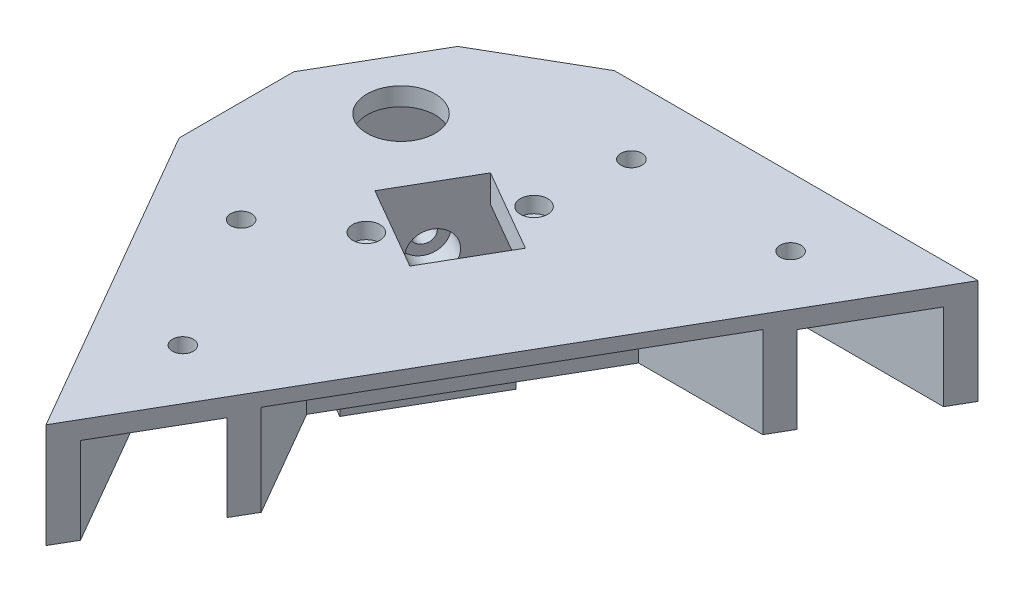
from build123d import *

# Parameters (mm, degrees)
BOSS_EXTRUDE1_DEPTH      = 23
SKETCH2_W                = 100.39999999999999
SKETCH2_H                = 20.400000000000002
CUT_EXTRUDE2_DEPTH       = 19
CUT_EXTRUDE3_DEPTH       = 19
CUT_EXTRUDE11_DEPTH      = 200.75985582694003
CUT_EXTRUDE11_DEPTH_BACK = 200.75985582694003
CUT_EXTRUDE10_DEPTH      = 20
SKETCH38_R               = 2.299999999999993
SKETCH38_R_2             = 2.300000000000006
SKETCH38_R_3             = 2.2999999999999985
SKETCH38_R_4             = 2.299999999999992
CUT_EXTRUDE24_DEPTH      = 10
BOSS_EXTRUDE2_DEPTH      = 6
SKETCH40_R               = 1.6500000000000017
CUT_EXTRUDE25_DEPTH      = 200.1582285520733
SKETCH41_R               = 3.0000000000000084
CUT_EXTRUDE26_DEPTH      = 3.5
SKETCH45_R               = 2.3
CUT_EXTRUDE29_DEPTH      = 130.1236252028075
SKETCH47_R               = 7.499999999999999
CUT_EXTRUDE31_DEPTH      = 10
CUT_EXTRUDE32_DEPTH      = 200.75985582694003
BOSS_EXTRUDE3_DEPTH      = 21
CUT_EXTRUDE33_DEPTH      = 200.75985582694003
CHAMFER6_SIZE            = 0.8
CHAMFER6_SIZE2           = 9.144041842209413
SKETCH51_R               = 4.5
CUT_EXTRUDE34_DEPTH      = 29.803050969
SKETCH52_R               = 2.3
CUT_EXTRUDE35_DEPTH      = 10
SKETCH53_W               = 20.000000000000007
SKETCH53_H               = 20
CUT_EXTRUDE36_DEPTH      = 10
SKETCH54_R               = 0.8500000000000069
CUT_EXTRUDE37_DEPTH      = 10
CHAMFER7_SIZE            = 1
CHAMFER7_SIZE_2          = 1.710027066
CHAMFER5_SIZE            = 14.54
CHAMFER4_SIZE            = 14.54


with BuildPart() as part:
    # Sketch1 → Boss-Extrude1 (new body)
    with BuildSketch(Plane(origin=(0, 0, 0), x_dir=(1, 0, 0), z_dir=(0, 1, 0))):
        Polygon((0, 0), (149.99999999999937, 0), (74.99999999999966, 129.903810567666), align=None)
    extrude(amount=BOSS_EXTRUDE1_DEPTH)

    # Sketch2 → Cut-Extrude2 (cut)
    with BuildSketch(Plane(origin=(0, 0, 0), x_dir=(1, 0, 0), z_dir=(0, 1, 0))):
        Polygon((108.9238401753675, 138.2616253392494), (58.72384017536752, 51.31267479929176), (41.05692193816496, 61.51267479929177), (91.25692193816495, 148.4616253392494), align=None)
        with Locations((124, 15.000000000000002)):
            Rectangle(SKETCH2_W, SKETCH2_H)
    extrude(amount=CUT_EXTRUDE2_DEPTH, mode=Mode.SUBTRACT)

    # Sketch4 → Cut-Extrude3 (cut)
    with BuildSketch(Plane(origin=(0, 0, 0), x_dir=(1, 0, 0), z_dir=(0, 1, 0))):
        Polygon((58.51558394542647, 45.56193363414623), (40.84866570822394, 35.36193363414623), (51.048665708223936, 17.69501539694368), (68.71558394542647, 27.895015396943673), align=None)
    extrude(amount=CUT_EXTRUDE3_DEPTH, mode=Mode.SUBTRACT)

    # Sketch22 → Cut-Extrude11 (cut, two sides: drawn at the far end of the back side and taken through both)
    with BuildSketch(Plane.XZ.offset(-CUT_EXTRUDE11_DEPTH_BACK)):
        Polygon((79.88924971530794, -26.147760514529192), (62.58924971530795, -56.11223948547077), (80.77578319478118, -66.61223948547077), (98.07578319478117, -36.64776051452918), align=None)
    extrude(amount=CUT_EXTRUDE11_DEPTH + CUT_EXTRUDE11_DEPTH_BACK, mode=Mode.SUBTRACT)

    # Sketch21 → Cut-Extrude10 (cut)
    with BuildSketch(Plane.XZ):
        Polygon((132.67949192431067, -29.999999999999993), (105.37797113249052, -29.999999999999993), (78.6697476797782, -76.26000000000042), (92.32050807568827, -99.90381056766569), align=None)
    extrude(amount=-CUT_EXTRUDE10_DEPTH, mode=Mode.SUBTRACT)

    # Sketch38 → Cut-Extrude24 (cut)
    with BuildSketch(Plane.XZ.offset(-19)):
        with Locations(Location((88.79999999999998, -15, 0), (0, 0, 270))):
            Circle(SKETCH38_R)
        with Locations(Location((123.8, -15, 0), (0, 0, 270))):
            Circle(SKETCH38_R_2)
        with Locations(Location((57.390381056766245, -69.40305585605834, 0), (0, 0, 270))):
            Circle(SKETCH38_R_3)
        with Locations(Location((74.89038105676623, -99.7139449885137, 0), (0, 0, 270))):
            Circle(SKETCH38_R_4)
    extrude(amount=-CUT_EXTRUDE24_DEPTH, mode=Mode.SUBTRACT)

    # Sketch39 → Boss-Extrude2 (add)
    with BuildSketch(Plane(origin=(0, 23, 0), x_dir=(1, 0, 0), z_dir=(0, 1, 0))):
        Polygon((62.58924971530795, 56.11223948547077), (80.77578319478118, 66.61223948547077), (84.77578319478118, 59.68403625519526), (66.58924971530797, 49.18403625519524), align=None)
        Polygon((98.07578319478117, 36.64776051452918), (79.88924971530794, 26.147760514529192), (75.88924971530795, 33.0759637448047), (94.07578319478117, 43.575963744804696), align=None)
    extrude(amount=-BOSS_EXTRUDE2_DEPTH)

    # Sketch40 → Cut-Extrude25 (cut, through all)
    with BuildSketch(Plane.XZ.offset(-17)):
        with Locations(Location((87.08251645504455, -34.68865704891005, 0), (0, 0, 270))):
            Circle(SKETCH40_R)
        with Locations(Location((73.58251645504457, -58.071342951089896, 0), (0, 0, 270))):
            Circle(SKETCH40_R)
    extrude(amount=-CUT_EXTRUDE25_DEPTH, mode=Mode.SUBTRACT)

    # Sketch41 → Cut-Extrude26 (cut)
    with BuildSketch(Plane(origin=(0, 23, 0), x_dir=(1, 0, 0), z_dir=(0, 1, 0))):
        with Locations(Location((73.58251645504457, 58.071342951089896, 0), (0, 0, 270))):
            Circle(SKETCH41_R)
        with Locations(Location((87.08251645504455, 34.68865704891005, 0), (0, 0, 270))):
            Circle(SKETCH41_R)
    extrude(amount=-CUT_EXTRUDE26_DEPTH, mode=Mode.SUBTRACT)

    # Sketch45 → Cut-Extrude29 (cut, through all)
    with BuildSketch(Plane(origin=(63.615583945425506, 0, -36.72847451554663), x_dir=(0.5, 0, 0.8660254037844386), z_dir=(-0.8660254037844387, 0, 0.5000000000000001))):
        with Locations((1.94809e-12, 9.5)):
            Circle(SKETCH45_R)
    extrude(amount=-CUT_EXTRUDE29_DEPTH, mode=Mode.SUBTRACT)

    # Sketch47 → Cut-Extrude31 (cut)
    with BuildSketch(Plane.XZ.offset(-19)):
        with Locations(Location((54.78212482682521, -31.62847451554496, 0), (0, 0, 270))):
            Circle(SKETCH47_R)
    extrude(amount=-CUT_EXTRUDE31_DEPTH, mode=Mode.SUBTRACT)

    # Sketch48 → Cut-Extrude32 (cut, through all)
    with BuildSketch(Plane.XZ):
        Polygon((55.491384919067684, 2e-17), (27.74569245953363, -48.05694903109369), (0, 0), align=None)
    extrude(amount=-CUT_EXTRUDE32_DEPTH, mode=Mode.SUBTRACT)

    # Sketch49 → Boss-Extrude3 (add)
    with BuildSketch(Plane.XZ):
        Polygon((48.718538689301745, -11.730913781805928), (75.91173636813312, -27.430913781805906), (61.7117363681331, -52.026035249283986), (34.51853868930174, -36.326035249284), align=None)
    extrude(amount=BOSS_EXTRUDE3_DEPTH)

    # Sketch50 → Cut-Extrude33 (cut, through all)
    with BuildSketch(Plane(origin=(0, 0, 0), x_dir=(1, 0, 0), z_dir=(0, 1, 0))):
        Polygon((40.84866570822394, 35.36193363414623), (58.51558394542647, 45.56193363414623), (68.71558394542649, 27.895015396943673), (51.048665708223936, 17.69501539694368), align=None)
    extrude(amount=-CUT_EXTRUDE33_DEPTH, mode=Mode.SUBTRACT)

    # Chamfer6
    chamfer6_edges = [part.edges().sort_by_distance(p)[0] for p in [
        (48.115137528717426, 0, -44.17603524928399),
        (62.31513752871743, 0, -19.58091378180592),
    ]]
    chamfer6_side = [part.faces().sort_by_distance(p)[0] for p in [
        (48.99845735329998, 0, -54.86781762841321),
    ]]
    chamfer(chamfer6_edges, length=CHAMFER6_SIZE, length2=CHAMFER6_SIZE2, reference=chamfer6_side[0])

    # Sketch51 → Cut-Extrude34 (cut)
    with BuildSketch(Plane(origin=(92.02385940613446, 0, -53.129999999999995), x_dir=(-0.4999999999999997, 0, -0.8660254037844388), z_dir=(0.8660254037844388, 0, -0.4999999999999997))):
        with Locations(Location((-1.92901e-12, 9.5, 0), (0, 0, 180))):
            Circle(SKETCH51_R)
    extrude(amount=-CUT_EXTRUDE34_DEPTH, mode=Mode.SUBTRACT)

    # Sketch52 → Cut-Extrude35 (cut)
    with BuildSketch(Plane(origin=(68.8117363681321, 0, -39.72847451554662), x_dir=(-0.49999999999999983, 0, -0.8660254037844387), z_dir=(0.8660254037844387, 0, -0.49999999999999983))):
        with Locations((-1.388e-14, -10)):
            Circle(SKETCH52_R)
    extrude(amount=-CUT_EXTRUDE35_DEPTH, mode=Mode.SUBTRACT)

    # Sketch53 → Cut-Extrude36 (cut)
    with BuildSketch(Plane(origin=(7.10000000000096, 0, 12.297560733740706), x_dir=(0.8660254037844387, 0, -0.49999999999999983), z_dir=(0.49999999999999983, 0, 0.8660254037844387))):
        with Locations((69.45694903109329, -11)):
            Rectangle(SKETCH53_W, SKETCH53_H)
    extrude(amount=CUT_EXTRUDE36_DEPTH, mode=Mode.SUBTRACT)

    # Sketch54 → Cut-Extrude37 (cut)
    with BuildSketch(Plane(origin=(7.10000000000096, 0, 12.297560733740706), x_dir=(0.8660254037844387, 0, -0.49999999999999983), z_dir=(0.49999999999999983, 0, 0.8660254037844387))):
        with Locations((64.5819490310929, -13.3999999999983)):
            Circle(SKETCH54_R)
        with Locations((74.58194903109292, -13.399999999998368)):
            Circle(SKETCH54_R)
    extrude(amount=-CUT_EXTRUDE37_DEPTH, mode=Mode.SUBTRACT)

    # Chamfer7
    # the kernel refuses this chamfer: 1.710027066, 1 mm, written as the material it takes off along each edge
    with BuildSketch(Plane(origin=(80.10050658552632, -1.0000000000000009, -29.026564170563404), x_dir=(0.07067759261755262, 0.9899589444048419, 0.12241718137025635), z_dir=(-0.866025403784439, 0, 0.49999999999999933))) as chamfer7_piece_1_section:
        Polygon((CHAMFER7_SIZE * 0.998511767905, CHAMFER7_SIZE * 0.0545366789897), (-CHAMFER7_SIZE_2 * 0.141355185248, CHAMFER7_SIZE_2 * 0.989958944496), (0, 0), align=None)
    chamfer7_piece_1 = extrude(amount=24.42540661325694, mode=Mode.PRIVATE)
    chamfer7_piece_1 = split(chamfer7_piece_1, bisect_by=Plane(origin=(69.16773960486616, -0.5972584462527297, -23.537265435119764), z_dir=(0.4999999999999995, 0, 0.866025403784439)), keep=Keep.TOP, mode=Mode.PRIVATE)
    add(chamfer7_piece_1, mode=Mode.SUBTRACT)

    # Chamfer5
    chamfer5_edges = [part.edges().sort_by_distance(p)[0] for p in [
        (55.491384919067684, 11.5, 2e-17),
    ]]
    chamfer(chamfer5_edges, length=CHAMFER5_SIZE)

    # Chamfer4
    chamfer4_edges = [part.edges().sort_by_distance(p)[0] for p in [
        (27.74569245953363, 11.5, -48.05694903109369),
    ]]
    chamfer(chamfer4_edges, length=CHAMFER4_SIZE)


with BuildPart() as body_2:
    # Mirror1: mirrored copy
    add(part.part.mirror(Plane.XY))


solid = body_2.part
